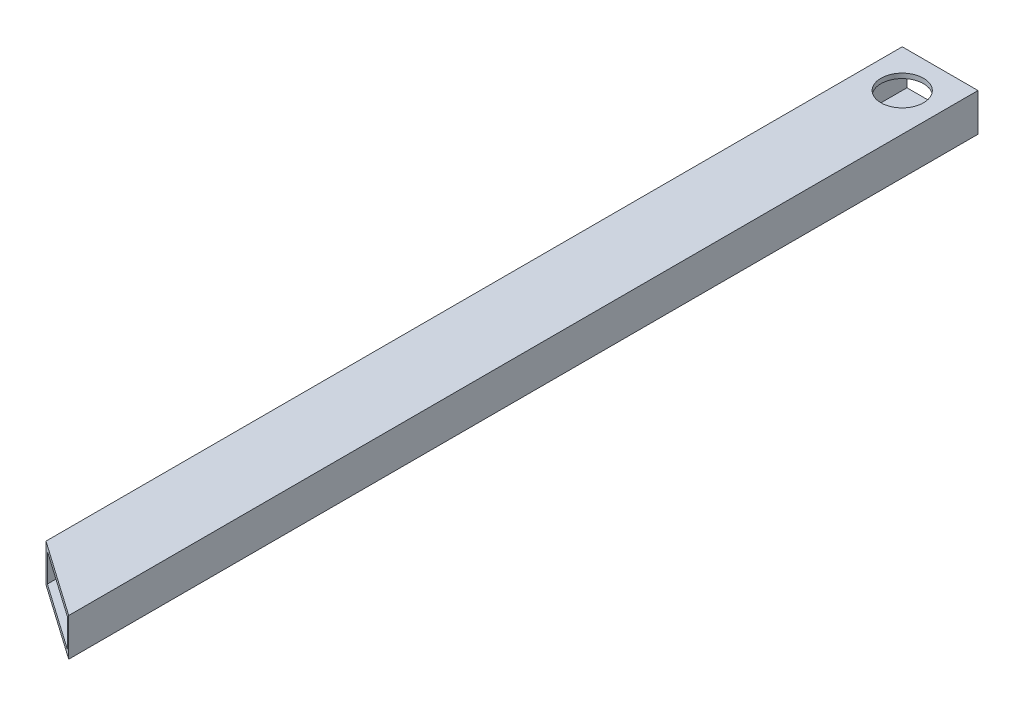
from build123d import *

# Parameters (mm, degrees)
SKETCH1_W           = 50.8
SKETCH1_H           = 25.4
BOSS_EXTRUDE1_DEPTH = 609.6
SKETCH2_W           = 44.45
SKETCH2_H           = 19.05
CUT_EXTRUDE1_DEPTH  = 609.6
SKETCH6_R           = 14.2875
CUT_EXTRUDE5_DEPTH  = 3.175
CUT_EXTRUDE6_DEPTH  = 25.4


with BuildPart() as part:
    # Sketch1 → Boss-Extrude1 (new body)
    with BuildSketch(Plane.XY):
        with Locations((25.4, 12.7)):
            Rectangle(SKETCH1_W, SKETCH1_H)
    extrude(amount=BOSS_EXTRUDE1_DEPTH)

    # Sketch2 → Cut-Extrude1 (cut)
    with BuildSketch(Plane(origin=(0, 0, 0), x_dir=(-1, 0, 0), z_dir=(0, 0, -1))):
        with Locations((-25.4, 12.7)):
            Rectangle(SKETCH2_W, SKETCH2_H)
    extrude(amount=-CUT_EXTRUDE1_DEPTH, mode=Mode.SUBTRACT)

    # Sketch6 → Cut-Extrude5 (cut)
    with BuildSketch(Plane(origin=(0, 25.4, 0), x_dir=(1, 0, 0), z_dir=(0, 1, 0))):
        with Locations((25.4, -25.4)):
            Circle(SKETCH6_R)
    extrude(amount=-CUT_EXTRUDE5_DEPTH, mode=Mode.SUBTRACT)

    # Sketch7 → Cut-Extrude6 (cut)
    with BuildSketch(Plane.XZ):
        Polygon((50.8, 609.6), (0, 574.029457059), (0, 609.6), align=None)
    extrude(amount=-CUT_EXTRUDE6_DEPTH, mode=Mode.SUBTRACT)


solid = part.part
